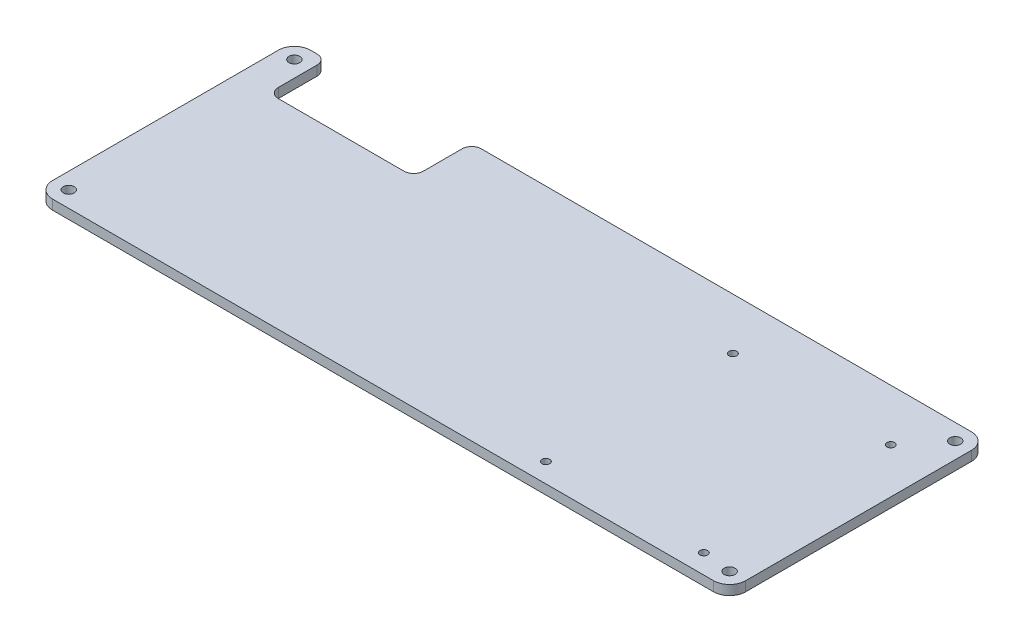
from build123d import *

# Parameters (mm, degrees)
ESQUISSE1_W             = 215
ESQUISSE1_H             = 80
BOSS_EXTRU_1_DEPTH      = 3
CONG_1_R                = 5
ESQUISSE2_R             = 1
ESQUISSE2_W             = 45
ESQUISSE2_H             = 18
ENL_V_MAT_EXTRU_1_DEPTH = 230.421010372
D_GAGEMENT_M31_D        = 3.4
D_GAGEMENT_M31_DEPTH    = 10
D_GAGEMENT_M31_TIP      = 1.021463052
CONG_2_R                = 3
D_GAGEMENT_M21_D        = 2.4


with BuildPart() as part:
    # Esquisse1 → Boss.-Extru.1 (new body)
    with BuildSketch(Plane(origin=(0, 0, 0), x_dir=(1, 0, 0), z_dir=(0, 1, 0))):
        with Locations((107.5, 40)):
            Rectangle(ESQUISSE1_W, ESQUISSE1_H)
    extrude(amount=BOSS_EXTRU_1_DEPTH)

    # Congé1
    cong_1_edges = [part.edges().sort_by_distance(p)[0] for p in [
        (0, 1.5, -80),
        (0, 1.5, 0),
        (215, 1.5, -80),
        (215, 1.5, 0),
    ]]
    fillet(cong_1_edges, radius=CONG_1_R)

    # Esquisse2 → Enlèv. mat.-Extru.1 (cut, through all)
    with BuildSketch(Plane(origin=(0, 3, 0), x_dir=(1, 0, 0), z_dir=(0, 1, 0))):
        with Locations((5, 75)):
            Circle(ESQUISSE2_R)
        with Locations((210, 75)):
            Circle(ESQUISSE2_R)
        with Locations((210, 5)):
            Circle(ESQUISSE2_R)
        with Locations((5, 5)):
            Circle(ESQUISSE2_R)
        with Locations((32.5, 71)):
            Rectangle(ESQUISSE2_W, ESQUISSE2_H)
    extrude(amount=-ENL_V_MAT_EXTRU_1_DEPTH, mode=Mode.SUBTRACT)

    # Dégagement M31
    with Locations(Plane(origin=(0, 3, 0), x_dir=(1, 0, 0), z_dir=(0, 1, 0))):
        with Locations((210, 5), (5, 5), (5, 75), (210, 75)):
            Hole(D_GAGEMENT_M31_D / 2, depth=D_GAGEMENT_M31_DEPTH)
            with Locations((0, 0, -(D_GAGEMENT_M31_DEPTH + D_GAGEMENT_M31_TIP / 2))):  # 118° drill point
                Cone(0, D_GAGEMENT_M31_D / 2, D_GAGEMENT_M31_TIP, mode=Mode.SUBTRACT)

    # Congé2
    cong_2_edges = [part.edges().sort_by_distance(p)[0] for p in [
        (55, 1.5, -62),
        (55, 1.5, -80),
        (10, 1.5, -80),
        (10, 1.5, -62),
    ]]
    fillet(cong_2_edges, radius=CONG_2_R)

    # Dégagement M21 (through all)
    with Locations(Plane(origin=(0, 3, 0), x_dir=(1, 0, 0), z_dir=(0, 1, 0))):
        with Locations((201, 64), (152, 64), (152, 6), (201, 6)):
            Hole(D_GAGEMENT_M21_D / 2)


solid = part.part
